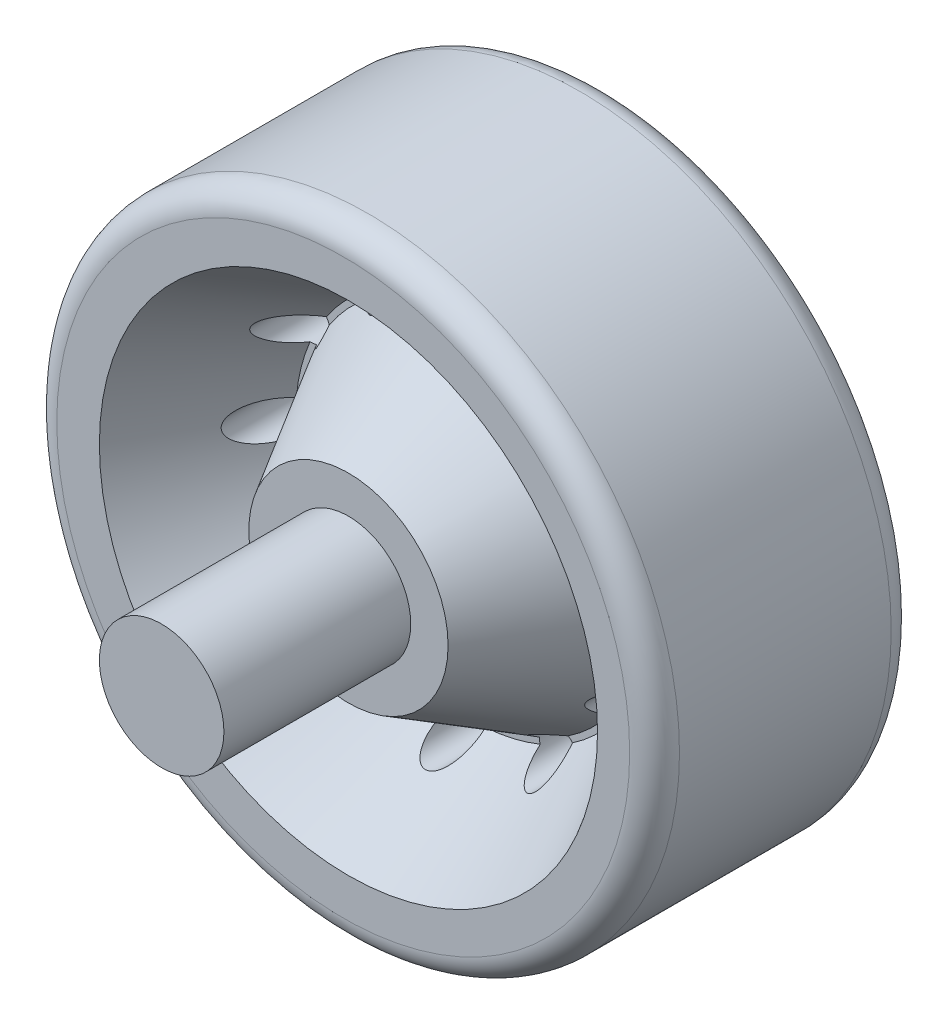
from build123d import *

# Parameters (mm, degrees)
SKETCH1_R           = 25
BOSS_EXTRUDE1_DEPTH = 21
SKETCH2_R           = 5
BOSS_EXTRUDE2_DEPTH = 15
FILLET3_R           = 2
SKETCH3_R           = 17.5
SKETCH3_R_2         = 5
CUT_EXTRUDE3_DEPTH  = 10
CUT_EXTRUDE3_DRAFT  = -30
SKETCH4_R           = 7.5
CUT_EXTRUDE6_DEPTH  = 3
SKETCH6_R           = 5
BOSS_EXTRUDE7_DEPTH = 5
SKETCH8_R           = 23
SKETCH8_R_2         = 20
BOSS_EXTRUDE8_DEPTH = 0.25
SKETCH9_R           = 0.75
CUT_EXTRUDE9_DEPTH  = 22
SKETCH12_R          = 1.5
CUT_EXTRUDE11_DEPTH = 25
FILLET6_R           = 1.5
SKETCH13_R          = 20
SKETCH13_R_2        = 8
CUT_EXTRUDE12_DEPTH = 10
CUT_EXTRUDE12_DRAFT = -30
SCALE1_SCALE        = 0.5


with BuildPart() as part:
    # Sketch1 → Boss-Extrude1 (new body)
    with BuildSketch(Plane.XY):
        Circle(SKETCH1_R)
    extrude(amount=BOSS_EXTRUDE1_DEPTH)

    # Sketch2 → Boss-Extrude2 (add)
    with BuildSketch(Plane(origin=(2.278104173, 2.660659618, 21), x_dir=(1, 0, 0), z_dir=(0, 0, 1))):
        with Locations((-1.857912582, -2.494740374)):
            Circle(SKETCH2_R)
    extrude(amount=BOSS_EXTRUDE2_DEPTH)

    # Fillet3
    fillet3_edges = [part.edges().sort_by_distance(p)[0] for p in [
        (-25, 0, 0),
        (-25, 0, 21),
    ]]
    fillet(fillet3_edges, radius=FILLET3_R)


with BuildPart() as cut_extrude3_tool:
    # Sketch3 → Cut-Extrude3 (with draft: the straight prism first)
    with BuildSketch(Plane(origin=(0, 0, 0), x_dir=(-1, 0, 0), z_dir=(0, 0, -1))):
        Circle(SKETCH3_R)
        Circle(SKETCH3_R_2, mode=Mode.SUBTRACT)
    extrude(amount=-CUT_EXTRUDE3_DEPTH)
    # Cut-Extrude3: the draft: its side faces are tilted about the plane it starts from
    cut_extrude3_sides = [cut_extrude3_tool.faces().sort_by_distance(p)[0] for p in [
        (17.5, 0, 5),
        (5, 0, 5),
    ]]
    draft(cut_extrude3_sides, Plane(origin=(0, 0, 0), x_dir=(-1, 0, 0), z_dir=(0, 0, -1)), CUT_EXTRUDE3_DRAFT)


with BuildPart() as part_1:
    add(part.part)

    # Cut-Extrude3: cut by cut_extrude3_tool
    add(cut_extrude3_tool.part, mode=Mode.SUBTRACT)

    # Sketch4 → Cut-Extrude6 (cut)
    with BuildSketch(Plane(origin=(0, 0, 0), x_dir=(-1, 0, 0), z_dir=(0, 0, -1))):
        Circle(SKETCH4_R)
    extrude(amount=-CUT_EXTRUDE6_DEPTH, mode=Mode.SUBTRACT)

    # Sketch6 → Boss-Extrude7 (add)
    with BuildSketch(Plane(origin=(0, 0, 3), x_dir=(-1, 0, 0), z_dir=(0, 0, -1))):
        Circle(SKETCH6_R)
    extrude(amount=BOSS_EXTRUDE7_DEPTH)

    # Sketch8 → Boss-Extrude8 (add)
    with BuildSketch(Plane(origin=(0, 0, 0), x_dir=(-1, 0, 0), z_dir=(0, 0, -1))):
        with Locations(Location((0, 0, 0), (0, 0, 180))):
            Circle(SKETCH8_R)
        Circle(SKETCH8_R_2, mode=Mode.SUBTRACT)
    extrude(amount=BOSS_EXTRUDE8_DEPTH)

    # Sketch9 → Cut-Extrude9 (cut)
    with BuildSketch(Plane(origin=(0, 0, -2), x_dir=(-1, 0, 0), z_dir=(0, 0, -1))):
        with Locations((3.5, 0)):
            Circle(SKETCH9_R)
        with Locations((2.505023076, -2.402086785)):
            Circle(SKETCH9_R)
        with Locations((0.102936291, -3.397063709)):
            Circle(SKETCH9_R)
        with Locations((-2.299150493, -2.402086785)):
            Circle(SKETCH9_R)
        with Locations((-3.294127417, 0)):
            Circle(SKETCH9_R)
        with Locations((-2.299150493, 2.402086785)):
            Circle(SKETCH9_R)
        with Locations((0.102936291, 3.397063709)):
            Circle(SKETCH9_R)
        with Locations((2.505023076, 2.402086785)):
            Circle(SKETCH9_R)
    extrude(amount=-CUT_EXTRUDE9_DEPTH, mode=Mode.SUBTRACT)

    # Sketch12 → Cut-Extrude11 (cut)
    with BuildSketch(Plane(origin=(0, 0, -2), x_dir=(-1, 0, 0), z_dir=(0, 0, -1))):
        with Locations(Location((7.25, 12.557368355, 0), (0, 0, 54.799536951))):
            Circle(SKETCH12_R)
        with Locations(Location((0, 14.5, 0), (0, 0, 82.485610598))):
            Circle(SKETCH12_R)
        with Locations(Location((-7.25, 12.557368355, 0), (0, 0, 125.200463049))):
            Circle(SKETCH12_R)
        with Locations(Location((14.5, 0, 0), (0, 0, 180))):
            Circle(SKETCH12_R)
        with Locations(Location((12.557368355, -7.25, 0), (0, 0, 324.799536951))):
            Circle(SKETCH12_R)
        with Locations(Location((7.25, -12.557368355, 0), (0, 0, 305.200463049))):
            Circle(SKETCH12_R)
        with Locations(Location((0, -14.5, 0), (0, 0, 277.514389402))):
            Circle(SKETCH12_R)
        with Locations(Location((-7.25, -12.557368355, 0), (0, 0, 243.295095203))):
            Circle(SKETCH12_R)
        with Locations(Location((-12.557368355, -7.25, 0), (0, 0, 215.937729886))):
            Circle(SKETCH12_R)
        with Locations(Location((-14.5, 0, 0), (0, 0, 187.514389402))):
            Circle(SKETCH12_R)
        with Locations(Location((-12.557368355, 7.25, 0), (0, 0, 144.799536951))):
            Circle(SKETCH12_R)
        with Locations(Location((12.557368355, 7.25, 0), (0, 0, 28.585427002))):
            Circle(SKETCH12_R)
    extrude(amount=-CUT_EXTRUDE11_DEPTH, mode=Mode.SUBTRACT)

    # Fillet6
    # the kernel refuses this fillet: 1.5 mm, written as the material it adds along each edge
    with BuildSketch(Plane(origin=(0, 0, 3), x_dir=(-1, 0, 0), z_dir=(0, -1, 0))) as fillet6_piece_1:
        with BuildLine():
            CenterArc((5 + FILLET6_R, FILLET6_R), FILLET6_R, 180, 90)
            Line((5, FILLET6_R), (5 - FILLET6_R * 0.02, FILLET6_R))
            Line((5 - FILLET6_R * 0.02, FILLET6_R), (5 - FILLET6_R * 0.02, -FILLET6_R * 0.02))
            Line((5 - FILLET6_R * 0.02, -FILLET6_R * 0.02), (5 + FILLET6_R, -FILLET6_R * 0.02))
            Line((5 + FILLET6_R, -FILLET6_R * 0.02), (5 + FILLET6_R, 0))
        make_face()
    revolve(axis=Axis((0, 0, 3), (0, 0, -1)))
    # the kernel refuses this fillet: 1.5 mm, written as the material it takes off along each edge
    with BuildSketch(Plane(origin=(0, 0, -2), x_dir=(-1, 0, 0), z_dir=(0, -1, 0))) as fillet6_2_piece_1:
        with BuildLine():
            CenterArc((5 - FILLET6_R, -FILLET6_R), FILLET6_R, 0, 90)
            Line((5 - FILLET6_R, 0), (5 - FILLET6_R, FILLET6_R * 0.02))
            Line((5 - FILLET6_R, FILLET6_R * 0.02), (5 + FILLET6_R * 0.02, FILLET6_R * 0.02))
            Line((5 + FILLET6_R * 0.02, FILLET6_R * 0.02), (5 + FILLET6_R * 0.02, -FILLET6_R))
            Line((5 + FILLET6_R * 0.02, -FILLET6_R), (5, -FILLET6_R))
        make_face()
    revolve(axis=Axis((0, 0, -2), (0, 0, -1)), mode=Mode.SUBTRACT)


with BuildPart() as cut_extrude12_tool:
    # Sketch13 → Cut-Extrude12 (with draft: the straight prism first)
    with BuildSketch(Plane.XY.offset(21)):
        with Locations((0.420191592, 0.165919244)):
            Circle(SKETCH13_R)
        with Locations((0.420191592, 0.165919244)):
            Circle(SKETCH13_R_2, mode=Mode.SUBTRACT)
    extrude(amount=-CUT_EXTRUDE12_DEPTH)
    # Cut-Extrude12: the draft: its side faces are tilted about the plane it starts from
    cut_extrude12_sides = [cut_extrude12_tool.faces().sort_by_distance(p)[0] for p in [
        (-19.579808408, 0.165919244, 16),
        (-7.579808408, 0.165919244, 16),
    ]]
    draft(cut_extrude12_sides, Plane.XY.offset(21), CUT_EXTRUDE12_DRAFT)


with BuildPart() as part_2:
    add(part_1.part)

    # Cut-Extrude12: cut by cut_extrude12_tool
    add(cut_extrude12_tool.part, mode=Mode.SUBTRACT)


with BuildPart() as part_3:
    # Scale1: scaled about (-0.050426099, -0.020410897, 10.984632193)
    add(part_2.part.scale(SCALE1_SCALE).moved(Location((-0.02521305, -0.010205449, 5.492316096))))


solid = part_3.part
